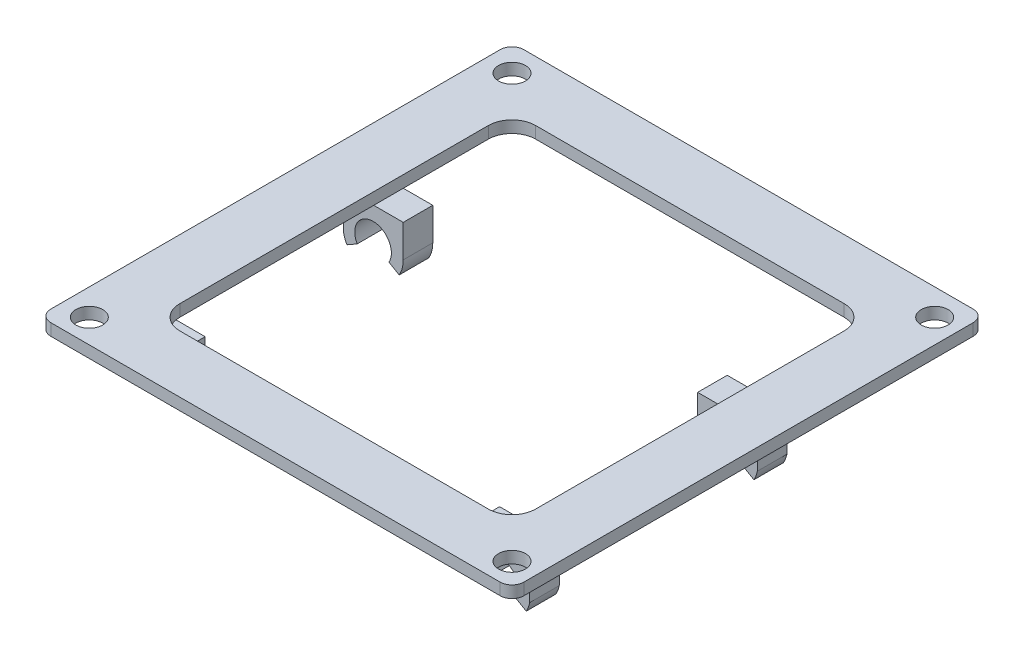
from build123d import *

# Parameters (mm, degrees)
SKETCH1_W               = 70
SKETCH1_H               = 57.5
BOSS_EXTRUDE1_DEPTH     = 8
BOSS_EXTRUDE2_START     = -2
SKETCH3_R               = 3.1
BOSS_EXTRUDE2_DEPTH     = 5
CUT_EXTRUDE1_DEPTH      = 10
CUT_EXTRUDE1_DEPTH_BACK = 63
MOVE_FACE1_BY           = 6
SKETCH5_W               = 80
SKETCH5_H               = 80
BOSS_EXTRUDE3_DEPTH     = 2
FILLET1_R               = 2
SKETCH6_R               = 2.275
CUT_EXTRUDE2_DEPTH      = 2
SKETCH7_W               = 60.186291501
SKETCH7_H               = 60.186291501
CUT_EXTRUDE3_DEPTH      = 2
FILLET2_R               = 4


with BuildPart() as part:
    # Sketch1 → Boss-Extrude1 (new body)
    with BuildSketch(Plane(origin=(0, 1.4, 0), x_dir=(1, 0, 0), z_dir=(0, 1, 0))):
        with Locations((0, 12.22)):
            Rectangle(SKETCH1_W, SKETCH1_H)
    extrude(amount=BOSS_EXTRUDE1_DEPTH)

    # Sketch3 → Boss-Extrude2 (add)
    # profile 1 of 2: a face of its own
    with BuildSketch(Plane(origin=(0, 0, -36.97), x_dir=(-1, 0, 0), z_dir=(0, 0, -1)).offset(BOSS_EXTRUDE2_START)):
        with BuildLine():
            ThreePointArc((-35, -5.104987562), (-29.495024753, -9.174938423), (-24.9, -4.1))
            Line((-24.9, -4.1), (-24.9, 1.4))
            Line((-24.9, 1.4), (-35, 1.4))
            Line((-35, 1.4), (-35, -5.104987562))
        make_face()
        with Locations(Location((-30, -4.1, 0), (0, 0, 180))):
            Circle(SKETCH3_R, mode=Mode.SUBTRACT)
    # profile 2 of 2: a face of its own
    with BuildSketch(Plane(origin=(0, 0, -36.97), x_dir=(-1, 0, 0), z_dir=(0, 0, -1)).offset(BOSS_EXTRUDE2_START)):
        with BuildLine():
            Line((35, 1.4), (35, -5.104987562))
            ThreePointArc((35, -5.104987562), (29.495024753, -9.174938423), (24.9, -4.1))
            Line((24.9, -4.1), (24.9, 1.4))
            Line((24.9, 1.4), (35, 1.4))
        make_face()
        with Locations(Location((30, -4.1, 0), (0, 0, 180))):
            Circle(SKETCH3_R, mode=Mode.SUBTRACT)
    boss_extrude2 = extrude(amount=-BOSS_EXTRUDE2_DEPTH)

    # Mirror1: Boss-Extrude2 across plane
    add(boss_extrude2.mirror(Plane.XY.offset(-13.22)))

    # Sketch4 → Cut-Extrude1 (cut, two sides: drawn at the far end of the back side and taken through both)
    with BuildSketch(Plane(origin=(0, 0, -29.97), x_dir=(-1, 0, 0), z_dir=(0, 0, -1)).offset(-CUT_EXTRUDE1_DEPTH_BACK)):
        Polygon((-30, -4.1), (-20, -9.873502692), (-40, -9.873502692), align=None)
        Polygon((20, -9.873502692), (40, -9.873502692), (30, -4.1), align=None)
    extrude(amount=CUT_EXTRUDE1_DEPTH + CUT_EXTRUDE1_DEPTH_BACK, mode=Mode.SUBTRACT)

    # Move Face1: a face moved inward by 6.0
    extrude(part.faces().sort_by_distance((0, 9.4, -12.22))[0], amount=MOVE_FACE1_BY, dir=(0, -1, 0), mode=Mode.SUBTRACT)

    # Sketch5 → Boss-Extrude3 (add)
    with BuildSketch(Plane(origin=(0, 3.4, 0), x_dir=(1, 0, 0), z_dir=(0, 1, 0))):
        with Locations((0, 23.47)):
            Rectangle(SKETCH5_W, SKETCH5_H)
    extrude(amount=-BOSS_EXTRUDE3_DEPTH)

    # Fillet1
    fillet1_edges = [part.edges().sort_by_distance(p)[0] for p in [
        (40, 2.4, 16.53),
        (-40, 2.4, 16.53),
        (-40, 2.4, -63.47),
        (40, 2.4, -63.47),
    ]]
    fillet(fillet1_edges, radius=FILLET1_R)

    # Sketch6 → Cut-Extrude2 (cut)
    with BuildSketch(Plane(origin=(0, 3.4, 0), x_dir=(1, 0, 0), z_dir=(0, 1, 0))):
        with Locations(Location((35.955095469, 59.014904531, 0), (0, 0, 180))):
            Circle(SKETCH6_R)
        with Locations(Location((35.955095469, -12.485095469, 0), (0, 0, 180))):
            Circle(SKETCH6_R)
        with Locations(Location((-35.544904531, 59.014904531, 0), (0, 0, 180))):
            Circle(SKETCH6_R)
        with Locations(Location((-35.544904531, -12.485095469, 0), (0, 0, 180))):
            Circle(SKETCH6_R)
    extrude(amount=-CUT_EXTRUDE2_DEPTH, mode=Mode.SUBTRACT)

    # Sketch7 → Cut-Extrude3 (cut)
    with BuildSketch(Plane(origin=(0, 3.4, 0), x_dir=(1, 0, 0), z_dir=(0, 1, 0))):
        with Locations((0.205095468, 23.264904532)):
            Rectangle(SKETCH7_W, SKETCH7_H)
    extrude(amount=-CUT_EXTRUDE3_DEPTH, mode=Mode.SUBTRACT)

    # Fillet2
    # the kernel refuses this fillet: 4 mm, written as the material it adds along each edge
    with BuildSketch(Plane(origin=(30.298241219, 3.4, -53.358050282), x_dir=(-1, 0, 0), z_dir=(0, -1, 0)), Plane(origin=(30.298241219, 3.4, 6.828241219), x_dir=(0, 0, -1), z_dir=(0, -1, 0)), Plane(origin=(-29.888050282, 3.4, -53.358050282), x_dir=(0, 0, 1), z_dir=(0, -1, 0))) as fillet2_piece_1:
        with BuildLine():
            CenterArc((FILLET2_R, -FILLET2_R), FILLET2_R, 90, 90)
            Line((0, -FILLET2_R), (0, 0))
            Line((0, 0), (FILLET2_R, 0))
        make_face()
    extrude(amount=2)
    with BuildSketch(Plane(origin=(-29.888050282, 3.4, 6.828241219), x_dir=(0, 0, -1), z_dir=(0, -1, 0))) as fillet2_piece_2:
        with BuildLine():
            CenterArc((FILLET2_R, FILLET2_R), FILLET2_R, 180, 90)
            Line((0, FILLET2_R), (0, 0))
            Line((0, 0), (FILLET2_R, 0))
        make_face()
    extrude(amount=2)


solid = part.part
